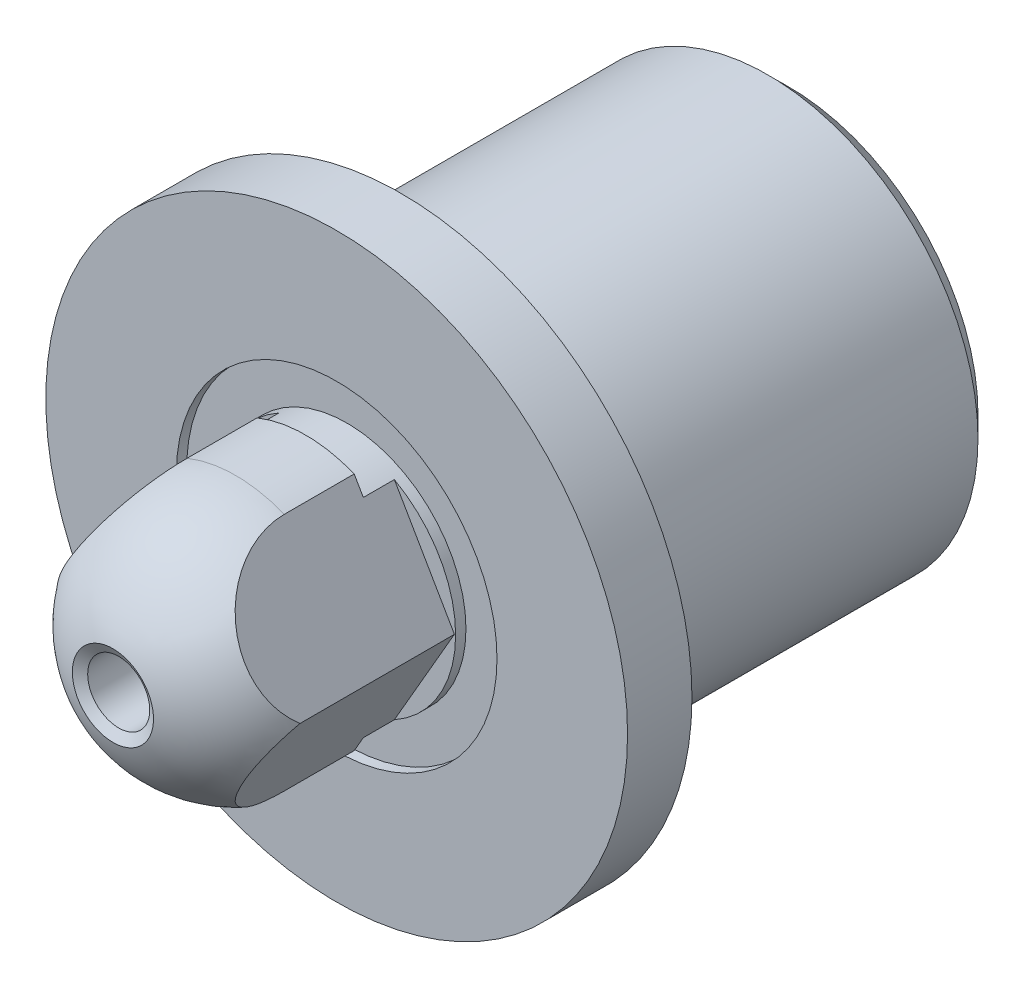
from build123d import *

# Parameters (mm, degrees)
SKETCH3_W          = 1.016
SKETCH3_H          = 1.016
CHAMFER1_SIZE      = 0.5159375
SKETCH2_R          = 0.762
CUT_EXTRUDE1_DEPTH = 2.54
CHAMFER2_SIZE      = 0.254
CHAMFER2_SIZE_2    = 0.209783356
SKETCH4_OUTSIDE_W  = 21.518
SKETCH4_OUTSIDE_H  = 21.518
CUT_EXTRUDE2_DEPTH = 5.655396081


with BuildPart() as part:
    # Sketch1 → Revolve1 (revolve)
    with BuildSketch(Plane(origin=(0, 0, 0), x_dir=(0, 0, -1), z_dir=(1, 0, 0)), mode=Mode.PRIVATE) as revolve1_sk:
        with BuildLine():
            Line((0, 0), (0, 5.159375))
            Line((0, 5.159375), (-9.525, 5.159375))
            Line((-9.525, 5.159375), (-9.525, 7.14375))
            Line((-9.525, 7.14375), (-11.10615, 7.14375))
            Line((-11.10615, 7.14375), (-11.10615, 3.175))
            Line((-11.10615, 3.175), (-13.586546081, 3.175))
            ThreePointArc((-13.586546081, 3.175), (-15.831610111, 2.24506403), (-16.761546081, 0))
            Line((-16.761546081, 0), (0, 0))
        make_face()
    revolve(revolve1_sk.sketch.rotate(Axis((0, 0, 17.33350529), (0, 0, -1)), 90), axis=Axis((0, 0, 17.33350529), (0, 0, -1)))

    # Sketch3 → Cut-Revolve1 (revolve, cut)
    with BuildSketch(Plane(origin=(0, 0, 0), x_dir=(0, 0, -1), z_dir=(1, 0, 0)), mode=Mode.PRIVATE) as cut_revolve1_sk:
        with Locations((-11.36015, 3.429)):
            Rectangle(SKETCH3_W, SKETCH3_H)
        with Locations((-9.271, 5.413375)):
            Rectangle(SKETCH3_W, SKETCH3_H)
    revolve(cut_revolve1_sk.sketch.rotate(Axis((0, 0, 17.33350529), (0, 0, -1)), 90), axis=Axis((0, 0, 17.33350529), (0, 0, -1)), mode=Mode.SUBTRACT)

    # Chamfer1
    chamfer1_edges = [part.edges().sort_by_distance(p)[0] for p in [
        (-5.159375, 0, 0),
    ]]
    chamfer(chamfer1_edges, length=CHAMFER1_SIZE)

    # Sketch2 → Cut-Extrude1 (cut)
    with BuildSketch(Plane(origin=(0, 0, 0), x_dir=(-1, 0, 0), z_dir=(0, 0, -1))):
        Circle(SKETCH2_R)
    cut_extrude1 = extrude(amount=-CUT_EXTRUDE1_DEPTH, mode=Mode.SUBTRACT)

    # Mirror1: Cut-Extrude1 across plane
    add(cut_extrude1.mirror(Plane.XY.offset(8.38077304)), mode=Mode.SUBTRACT)

    # Chamfer2
    # the kernel refuses this chamfer: 0.254, 0.209783356 mm, written as the material it takes off along each edge
    with BuildSketch(Plane(origin=(0, 0, 0), x_dir=(-1, 0, 0), z_dir=(0, -1, 0))) as chamfer2_piece_1:
        Polygon((0.762 + CHAMFER2_SIZE, 0), (0.762, -CHAMFER2_SIZE), (0.762, 0), align=None)
    revolve(axis=Axis((0, 0, 0), (0, 0, -1)), mode=Mode.SUBTRACT)
    with BuildSketch(Plane(origin=(1e-09, -1e-09, 16.66875), x_dir=(1.0, 1.2724919857814273e-09, -4.6623539153921465e-15), z_dir=(-1.2724919857814273e-09, 1.0, 2.691811803016297e-15))) as chamfer2_piece_2:
        with BuildLine():
            Line((0.997154657, 0.067853643), (0.761999999, CHAMFER2_SIZE_2))
            Line((0.761999999, CHAMFER2_SIZE_2), (0.761999999, 0))
            ThreePointArc((0.761999999, 0), (0.883545151, 0.032618216), (0.997154657, 0.067853643))
        make_face()
    revolve(axis=Axis((1e-09, -1e-09, 16.66875), (0, 0, -1)), revolution_arc=180.000000146, mode=Mode.SUBTRACT)
    with BuildSketch(Plane(origin=(1e-09, 1e-09, 16.66875), x_dir=(-1.0, -1.0948837603327353e-09, 4.6623539045804394e-15), z_dir=(1.0948837603327353e-09, -1.0, -8.075425709502658e-15))) as chamfer2_piece_3:
        with BuildLine():
            Line((0.997154658, 0.067853643), (0.761999999, 0.209783357))
            Line((0.761999999, 0.209783357), (0.762000001, 0))
            ThreePointArc((0.762000001, 0), (0.883545153, 0.032618216), (0.997154658, 0.067853643))
        make_face()
    revolve(axis=Axis((1e-09, 1e-09, 16.66875), (0, 0, -1)), revolution_arc=180.000000125, mode=Mode.SUBTRACT)

    # Sketch4 outside → Cut-Extrude2 (cut)
    with BuildSketch(Plane.XY.offset(16.761546081)):
        Rectangle(SKETCH4_OUTSIDE_W, SKETCH4_OUTSIDE_H)
        Polygon((-2.891420438, 0), (-1.058333333, 3.175), (1.058333333, 3.175), (2.891420438, 0), (1.058333333, -3.175), (-1.058333333, -3.175), align=None, mode=Mode.SUBTRACT)
    extrude(amount=-CUT_EXTRUDE2_DEPTH, mode=Mode.SUBTRACT)


solid = part.part
